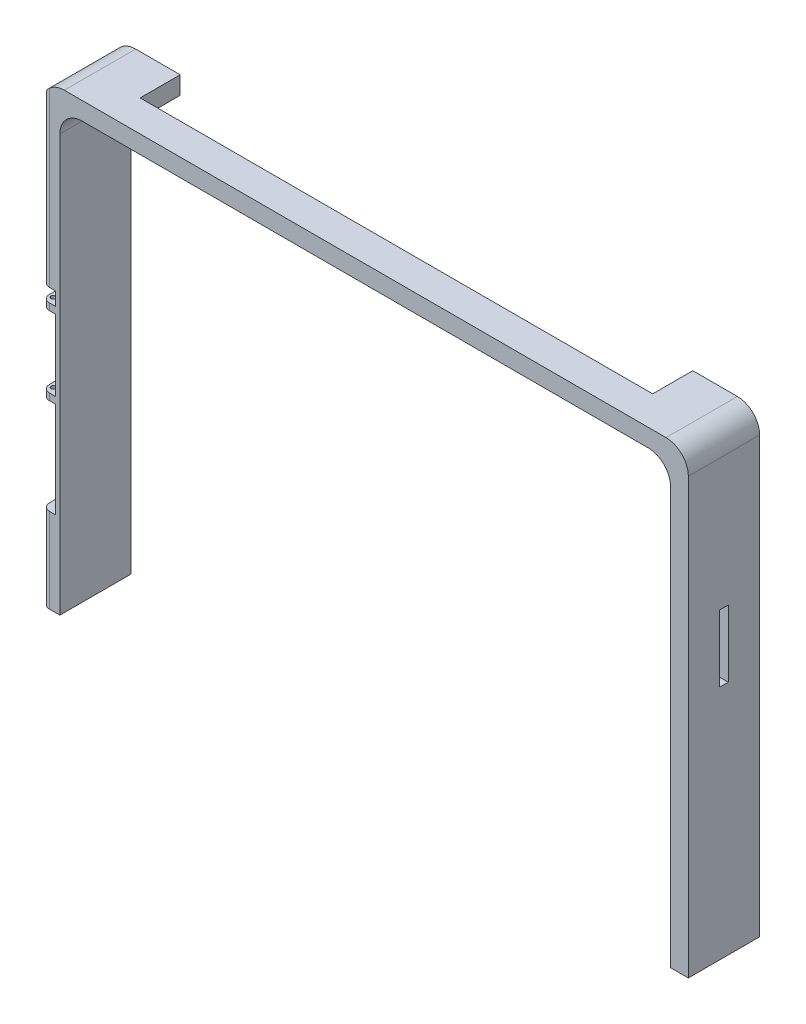
from build123d import *

# Parameters (mm, degrees)
EXTRUDE_1_DEPTH     = 32
SKETCH_2_R          = 2.05
CUT_EXTRUDE_1_DEPTH = 5.1
SKETCH_3_W          = 230
SKETCH_3_H          = 18
CUT_EXTRUDE_2_DEPTH = 8
SKETCH_4_W          = 6
SKETCH_4_H          = 32
SKETCH_4_H_2        = 6
SKETCH_4_H_3        = 43
CUT_EXTRUDE_3_DEPTH = 6
SKETCH_5_R          = 1
CUT_EXTRUDE_4_DEPTH = 38
SKETCH_6_W          = 4
SKETCH_6_H          = 30
CUT_EXTRUDE_5_DEPTH = 335.984621748
CHAMFER_1_SIZE2     = 8
CHAMFER_1_SIZE      = 0.3
CUT_EXTRUDE_6_DEPTH = 258.992463284


with BuildPart() as part:
    # 草图1 → 凸台-拉伸1 (new body)
    with BuildSketch(Plane.XY):
        with BuildLine():
            Line((145.333333333, -27.048611111), (153.333333333, -27.048611111))
            Line((153.333333333, -27.048611111), (153.333333333, 167.951388889))
            ThreePointArc((153.333333333, 167.951388889), (150.404401145, 175.022456701), (143.333333333, 177.951388889))
            Line((143.333333333, 177.951388889), (-126.666666667, 177.951388889))
            ThreePointArc((-126.666666667, 177.951388889), (-133.737734479, 175.022456701), (-136.666666667, 167.951388889))
            Line((-136.666666667, 167.951388889), (-136.666666667, -27.048611111))
            Line((-136.666666667, -27.048611111), (-128.666666667, -27.048611111))
            Line((-128.666666667, -27.048611111), (-128.666666667, 159.951388889))
            ThreePointArc((-128.666666667, 159.951388889), (-125.737734479, 167.022456701), (-118.666666667, 169.951388889))
            Line((-118.666666667, 169.951388889), (135.333333333, 169.951388889))
            ThreePointArc((135.333333333, 169.951388889), (142.404401145, 167.022456701), (145.333333333, 159.951388889))
            Line((145.333333333, 159.951388889), (145.333333333, -27.048611111))
        make_face()
    extrude(amount=EXTRUDE_1_DEPTH)

    # 草图2 → 切除-拉伸1 (cut)
    with BuildSketch(Plane(origin=(0, 0, 0), x_dir=(-1, 0, 0), z_dir=(0, 0, -1))):
        with Locations((132.666666667, 127.951388889)):
            Circle(SKETCH_2_R)
        with Locations((132.666666667, 24.951388889)):
            Circle(SKETCH_2_R)
        with Locations((-149.333333333, 127.951388889)):
            Circle(SKETCH_2_R)
        with Locations((-149.333333333, 24.951388889)):
            Circle(SKETCH_2_R)
        with Locations((-135.333333333, 173.951388889)):
            Circle(SKETCH_2_R)
        with Locations((-8.333333333, 173.951388889)):
            Circle(SKETCH_2_R)
        with Locations((118.666666667, 173.951388889)):
            Circle(SKETCH_2_R)
    extrude(amount=-CUT_EXTRUDE_1_DEPTH, mode=Mode.SUBTRACT)

    # 草图3 → 切除-拉伸2 (cut)
    with BuildSketch(Plane(origin=(0, 177.951388889, 0), x_dir=(1, 0, 0), z_dir=(0, 1, 0))):
        with Locations((8.333333333, -9)):
            Rectangle(SKETCH_3_W, SKETCH_3_H)
    extrude(amount=-CUT_EXTRUDE_2_DEPTH, mode=Mode.SUBTRACT)

    # 草图4 → 切除-拉伸3 (cut)
    with BuildSketch(Plane.ZY.offset(136.666666667)):
        with Locations((29, 72.951388889)):
            Rectangle(SKETCH_4_W, SKETCH_4_H)
        with Locations((29, 94.951388889)):
            Rectangle(SKETCH_4_W, SKETCH_4_H_2)
        with Locations((29, 32.451388889)):
            Rectangle(SKETCH_4_W, SKETCH_4_H_3)
    extrude(amount=-CUT_EXTRUDE_3_DEPTH, mode=Mode.SUBTRACT)

    # 草图5 → 切除-拉伸4 (cut)
    with BuildSketch(Plane.XZ.offset(-53.951388889)):
        with Locations(Location((-134.666666667, 29, 0), (0, 0, 270))):
            Circle(SKETCH_5_R)
    extrude(amount=-CUT_EXTRUDE_4_DEPTH, mode=Mode.SUBTRACT)

    # 草图6 → 切除-拉伸5 (cut, through all)
    with BuildSketch(Plane.ZY.offset(-145.333333333)):
        with Locations((16.078720605, 93.951388889)):
            Rectangle(SKETCH_6_W, SKETCH_6_H)
    extrude(amount=-CUT_EXTRUDE_5_DEPTH, mode=Mode.SUBTRACT)

    # 倒角1
    chamfer_1_edges = [part.edges().sort_by_distance(p)[0] for p in [
        (145.333333333, 93.951388889, 18.078720605),
    ]]
    chamfer_1_side = [part.faces().sort_by_distance(p)[0] for p in [
        (145.333333333, 93.951388889, 18.084720605),
    ]]
    chamfer(chamfer_1_edges, length=CHAMFER_1_SIZE - 0.0001, length2=CHAMFER_1_SIZE2 - 0.0001, reference=chamfer_1_side[0])  # a hair under: the kernel refuses the full size

    # 草图7 → 切除-拉伸6 (cut, through all)
    with BuildSketch(Plane(origin=(0, 177.951388889, 0), x_dir=(1, 0, 0), z_dir=(0, 1, 0))):
        with BuildLine():
            Line((-136.666666667, -28.7), (-136.666666667, -32))
            Line((-136.666666667, -32), (-133.366666667, -32))
            ThreePointArc((-133.366666667, -32), (-135.700119045, -31.033452378), (-136.666666667, -28.7))
        make_face()
    extrude(amount=-CUT_EXTRUDE_6_DEPTH, mode=Mode.SUBTRACT)


solid = part.part
